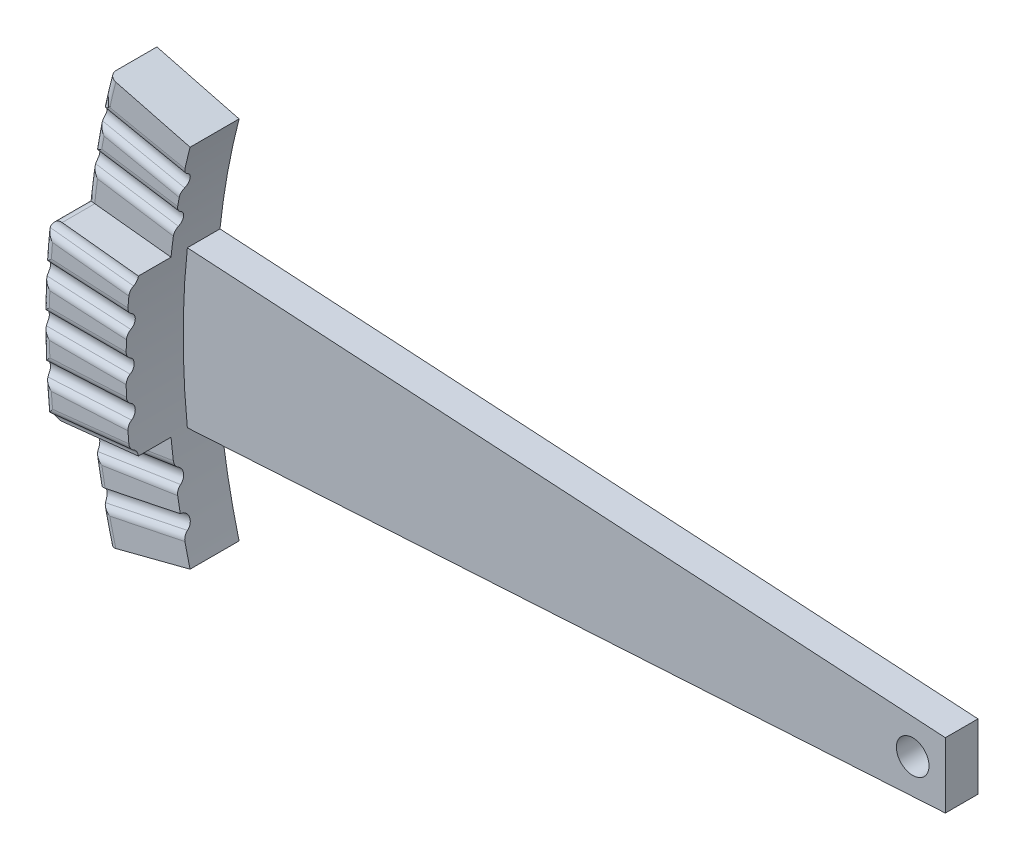
from build123d import *

# Parameters (mm, degrees)
MAIN_BODY_DEPTH                               = 1.5
UPPER_NOTCH_DEPTH                             = 1.25
UPPER_START                                   = -26
UPPER_NOTCH_RIDGE_CUT_DEPTH                   = 3.777933763
UPPER_NOTCH_RIDGE_CUT_PATTERN_COUNT           = 3
UPPER_NOTCH_RIDGE_CUT_PATTERN_ANGLE           = 6.140000000000013
UPPER_NOTCH_RIDGE_CUT_PATTERN_THE_OTHER_COUNT = 3
UPPER_NOTCH_RIDGE_CUT_PATTERN_THE_OTHER_ANGLE = 6.140000000000013
PIVOT_ARM_BODY_SKETCH_R                       = 0.5
PIVOT_ARM_BODY_DEPTH                          = 1
LOWER_NOTCH_RIDGE_CUT_SKETCH_R                = 0.25
LOWER_NOTCH_RIDGE_CUT_PATTERN_COUNT           = 2
LOWER_NOTCH_RIDGE_CUT_PATTERN_ANGLE           = 2.900000000000006
LOWER_NOTCH_RIDGE_CUT_PATTERN_MIRROR_COP_R    = 0.25
RIDGE_FILLETS_R                               = 0.25


with BuildPart() as part:
    # Main Body Sketch → Main Body (new body)
    with BuildSketch(Plane.XY):
        with BuildLine():
            Line((-24.15450268583479, 6.25), (-21.637400201539382, 5.598697394789582))
            ThreePointArc((-21.637400201539382, 5.598697394789582), (-22.35, -2.74e-15), (-21.637400201539382, -5.598697394789582))
            Line((-21.637400201539382, -5.598697394789582), (-24.15450268583479, -6.25))
            ThreePointArc((-24.15450268583479, -6.25), (-24.95, -3.06e-15), (-24.15450268583479, 6.25))
        make_face()
    extrude(amount=MAIN_BODY_DEPTH)

    # Upper Notch Sketch → Upper Notch (add)
    with BuildSketch(Plane.XY.offset(1.5)):
        with BuildLine():
            Line((-24.80718356191684, 2.665735119130029), (-22.222066236827313, 2.3879430826675807))
            ThreePointArc((-22.222066236827313, 2.3879430826675807), (-22.35000000000001, 2.74e-15), (-22.222066236827313, -2.3879430826675807))
            Line((-22.222066236827313, -2.3879430826675807), (-24.80718356191684, -2.665735119130029))
            ThreePointArc((-24.80718356191684, -2.665735119130029), (-24.950000000000006, 3.06e-15), (-24.80718356191684, 2.665735119130029))
        make_face()
    extrude(amount=UPPER_NOTCH_DEPTH)

    # Upper Notch Ridge Cut: read off the stored shape, not the designer's step
    # Upper Notch Ridge Cut outline → Upper Notch Ridge Cut (cut)
    with BuildSketch(Plane.YZ.offset(UPPER_START)):
        with BuildLine():
            Line((0.25, 2.75), (-0.25, 2.75))
            ThreePointArc((-0.25, 2.75), (0, 2.5), (0.25, 2.75))
        make_face()
    upper_notch_ridge_cut = extrude(amount=UPPER_NOTCH_RIDGE_CUT_DEPTH, mode=Mode.SUBTRACT)

    # Upper Notch Ridge Cut Pattern: Upper Notch Ridge Cut ×3 about axis
    upper_notch_ridge_cut_pattern_axis = Axis((0, 0, 2.75), (0, 0, -1))
    for i in range(1, UPPER_NOTCH_RIDGE_CUT_PATTERN_COUNT):
        add(upper_notch_ridge_cut.rotate(upper_notch_ridge_cut_pattern_axis, i * UPPER_NOTCH_RIDGE_CUT_PATTERN_ANGLE / (UPPER_NOTCH_RIDGE_CUT_PATTERN_COUNT - 1)), mode=Mode.SUBTRACT)

    # Upper Notch Ridge Cut Pattern the other: Upper Notch Ridge Cut ×3 about axis
    upper_notch_ridge_cut_pattern_the_other_axis = Axis((0, 0, 2.75), (0, 0, 1))
    for i in range(1, UPPER_NOTCH_RIDGE_CUT_PATTERN_THE_OTHER_COUNT):
        add(upper_notch_ridge_cut.rotate(upper_notch_ridge_cut_pattern_the_other_axis, i * UPPER_NOTCH_RIDGE_CUT_PATTERN_THE_OTHER_ANGLE / (UPPER_NOTCH_RIDGE_CUT_PATTERN_THE_OTHER_COUNT - 1)), mode=Mode.SUBTRACT)

    # Pivot Arm Body Sketch → Pivot Arm Body (add)
    with BuildSketch(Plane.XY):
        with BuildLine():
            Line((1, -0.9999999999999998), (0.9999999999999998, 1.0000000000000002))
            Line((0.9999999999999998, 1.0000000000000002), (-22.22206623682734, 2.387943082667429))
            ThreePointArc((-22.22206623682734, 2.387943082667429), (-22.35000000000002, 2.74e-15), (-22.22206623682734, -2.387943082667434))
            Line((-22.22206623682734, -2.387943082667434), (1, -0.9999999999999998))
        make_face()
        Circle(PIVOT_ARM_BODY_SKETCH_R, mode=Mode.SUBTRACT)
    extrude(amount=PIVOT_ARM_BODY_DEPTH)

    # Lower Notch Ridge Cut: sweep along a path in Lower Notch Ridge Cut Path
    with BuildLine(Plane.XY.offset(1.5)) as lower_notch_ridge_cut_path:
        Line((0, 0), (-24.433848267319885, -5.0487185353898685))
    # Lower Notch Ridge Cut Sketch → Lower Notch Ridge Cut (sweep, cut)
    with BuildSketch(Plane(origin=(0, 0, 1.5), x_dir=(0, 0, 1), z_dir=(-0.9793125558044041, -0.20235344831221916, 0))):
        Circle(LOWER_NOTCH_RIDGE_CUT_SKETCH_R)
    lower_notch_ridge_cut = sweep(path=lower_notch_ridge_cut_path.line, mode=Mode.SUBTRACT)

    # Lower Notch Ridge Cut Pattern: Lower Notch Ridge Cut ×2 about axis
    lower_notch_ridge_cut_pattern_axis = Axis((0, 0, 1.5), (0, 0, -1))
    for i in range(1, LOWER_NOTCH_RIDGE_CUT_PATTERN_COUNT):
        add(lower_notch_ridge_cut.rotate(lower_notch_ridge_cut_pattern_axis, i * LOWER_NOTCH_RIDGE_CUT_PATTERN_ANGLE / (LOWER_NOTCH_RIDGE_CUT_PATTERN_COUNT - 1)), mode=Mode.SUBTRACT)

    # Lower Notch Ridge Cut Pattern Mirror: Lower Notch Ridge Cut across plane
    add(lower_notch_ridge_cut.mirror(Plane.ZX), mode=Mode.SUBTRACT)

    # Lower Notch Ridge Cut Pattern Mirror 2: sweep along a path in Lower Notch Ridge Cut Pattern Mirror 3
    with BuildLine(Plane(origin=(0, 0, 1.5), x_dir=(0.9987193571841861, 0.050592940076713416, 0), z_dir=(0, 0, 1))) as lower_notch_ridge_cut_pattern_mirror_2_path:
        Line((0, 0), (-24.433848267319885, 5.0487185353898685))
    # Lower Notch Ridge Cut Pattern Mirror cop → Lower Notch Ridge Cut Pattern Mirror 2 (sweep, cut)
    with BuildSketch(Plane(origin=(0, 0, 1.5), x_dir=(0, 0, 1), z_dir=(-0.9882960621001533, 0.15254800437019767, 0))):
        Circle(LOWER_NOTCH_RIDGE_CUT_PATTERN_MIRROR_COP_R)
    sweep(path=lower_notch_ridge_cut_pattern_mirror_2_path.line, mode=Mode.SUBTRACT)

    # Ridge Fillets
    # the kernel refuses this fillet: 0.25 mm, written as the material it takes off along each edge
    with BuildSketch(Plane(origin=(-3.197e-14, 2.2e-16, 1.5), x_dir=(-0.9904771316155567, 0.1376773465266497, 0), z_dir=(-0.1376773465266497, -0.9904771316155567, 0))) as ridge_fillets_piece_1:
        with BuildLine():
            CenterArc((24.949999999999967 - RIDGE_FILLETS_R, RIDGE_FILLETS_R), RIDGE_FILLETS_R, 270, 90)
            Line((24.949999999999967, RIDGE_FILLETS_R), (24.949999999999967, 0))
            Line((24.949999999999967, 0), (24.949999999999967 - RIDGE_FILLETS_R, 0))
        make_face()
    ridge_fillets_piece_1_solid = revolve(axis=Axis((-3.197e-14, 2.2e-16, 1.5), (0, 0, -1)), revolution_arc=4.622299243658768, mode=Mode.PRIVATE)
    with BuildSketch(Plane(origin=(-21.488788064492436, 4.184905361020462, 1.5), x_dir=(0.05237292626537251, 0.25346474055021295, -0.965925826289066), z_dir=(-0.9793125558044041, 0.20235344831221916, 0))) as ridge_fillets_piece_2:
        with BuildLine():
            CenterArc((0.19411428382688892, 0.24148145657226713), RIDGE_FILLETS_R, 195.0000000000001, 60.00000000000023)
            Line((-0.04736717274537799, 0.17677669529663642), (0, 0))
            ThreePointArc((0, 0), (0.06470476127563021, 0.00851854342773308), (0.12940952255126043, 0))
        make_face()
    ridge_fillets_piece_2_solid = extrude(amount=3.515209227040651, mode=Mode.PRIVATE)
    with BuildSketch(Plane(origin=(-21.38761134033633, 4.6745616389226665, 1.5), x_dir=(0.20235344831221913, 0.9793125558044042, 0), z_dir=(-0.9793125558044041, 0.20235344831221916, 0))) as ridge_fillets_piece_3:
        with BuildLine():
            CenterArc((0.1830127018922193, 0.25000000000000006), RIDGE_FILLETS_R, 210, 60)
            ThreePointArc((-0.03349364905389055, 0.12500000000000003), (-0.00851854342773334, 0.06470476127562998), (0, 0))
            Line((0, 0), (0.1830127018922193, 0))
        make_face()
    ridge_fillets_piece_3_solid = extrude(amount=3.515209227040651, mode=Mode.PRIVATE)
    with BuildSketch(Plane(origin=(-3.197e-14, 2.2e-16, 1.5), x_dir=(-0.9942758942652038, 0.10684309094709553, 0), z_dir=(-0.10684309094709553, -0.9942758942652038, 0))) as ridge_fillets_piece_4:
        with BuildLine():
            CenterArc((24.949999999999974 - RIDGE_FILLETS_R, RIDGE_FILLETS_R), RIDGE_FILLETS_R, 270, 90)
            Line((24.949999999999974, RIDGE_FILLETS_R), (24.949999999999974, 0))
            Line((24.949999999999974, 0), (24.949999999999974 - RIDGE_FILLETS_R, 0))
        make_face()
    ridge_fillets_piece_4_solid = revolve(axis=Axis((-3.197e-14, 2.2e-16, 1.5), (0, 0, -1)), revolution_arc=3.50240050635555, mode=Mode.PRIVATE)
    with BuildSketch(Plane(origin=(-21.672995268593926, 3.092365025166951, 1.5), x_dir=(0.039482328823389555, 0.2557898430713422, -0.9659258262890685), z_dir=(-0.9882960621001534, 0.15254800437019767, 0))) as ridge_fillets_piece_5:
        with BuildLine():
            CenterArc((0.19411428382689072, 0.24148145657226722), RIDGE_FILLETS_R, 194.99999999999994, 60)
            Line((-0.0473671727453764, 0.17677669529663725), (0, 0))
            ThreePointArc((0, 0), (0.06470476127563024, 0.00851854342773269), (0.12940952255126034, 1e-17))
        make_face()
    ridge_fillets_piece_5_solid = extrude(amount=3.515209227040661, mode=Mode.PRIVATE)
    with BuildSketch(Plane(origin=(-21.59672126640883, 3.5865130562170284, 1.5), x_dir=(0.15254800437019767, 0.9882960621001533, 0), z_dir=(-0.9882960621001534, 0.15254800437019767, 0))) as ridge_fillets_piece_6:
        with BuildLine():
            CenterArc((0.1830127018922178, 0.25), RIDGE_FILLETS_R, 210.00000000000017, 59.99999999999983)
            ThreePointArc((-0.03349364905389141, 0.12499999999999933), (-0.00851854342773311, 0.06470476127562974), (0, 0))
            Line((0, 0), (0.1830127018922178, 0))
        make_face()
    ridge_fillets_piece_6_solid = extrude(amount=3.5152092270406503, mode=Mode.PRIVATE)
    with BuildSketch(Plane(origin=(-3.197e-14, 2.2e-16, 1.5), x_dir=(-0.9858917426492836, -0.16738420408138513, 0), z_dir=(0.16738420408138513, -0.9858917426492836, 0))) as ridge_fillets_piece_7:
        with BuildLine():
            CenterArc((24.949999999999974 - RIDGE_FILLETS_R, RIDGE_FILLETS_R), RIDGE_FILLETS_R, 270, 90)
            Line((24.949999999999974, RIDGE_FILLETS_R), (24.949999999999974, 0))
            Line((24.949999999999974, 0), (24.949999999999974 - RIDGE_FILLETS_R, 0))
        make_face()
    ridge_fillets_piece_7_solid = revolve(axis=Axis((-3.197e-14, 2.2e-16, 1.5), (0, 0, -1)), revolution_arc=3.50240050635566, mode=Mode.PRIVATE)
    with BuildSketch(Plane(origin=(-3.5705e-13, 0, 2.75), x_dir=(-0.9976471539131364, -0.06855768584935372, 0), z_dir=(0.06855768584935372, -0.9976471539131364, 0))) as ridge_fillets_piece_8:
        with BuildLine():
            CenterArc((24.94999999999965 - RIDGE_FILLETS_R, RIDGE_FILLETS_R), RIDGE_FILLETS_R, 270, 90)
            Line((24.94999999999965, RIDGE_FILLETS_R), (24.94999999999965, 0))
            Line((24.94999999999965, 0), (24.94999999999965 - RIDGE_FILLETS_R, 0))
        make_face()
    ridge_fillets_piece_8_solid = revolve(axis=Axis((-3.5705e-13, 0, 2.75), (0, 0, -1)), revolution_arc=4.792299332536204, mode=Mode.PRIVATE)
    with BuildSketch(Plane(origin=(-25.406279218280698, 0.25, 2.75), x_dir=(0, 1, 0), z_dir=(1, 0, 0))) as ridge_fillets_piece_9:
        with BuildLine():
            CenterArc((0.18301270189221974, -0.25), RIDGE_FILLETS_R, 90, 60)
            ThreePointArc((-0.03349364905388999, -0.125), (-0.00851854342773289, -0.06470476127562996), (0, 0))
            Line((0, 0), (0.18301270189221974, 0))
        make_face()
    ridge_fillets_piece_9_solid = extrude(amount=3.5152092270406357, mode=Mode.PRIVATE)
    with BuildSketch(Plane(origin=(-25.406279218280698, -0.25, 2.75), x_dir=(0, 0.25881904510251985, -0.9659258262890685), z_dir=(1, 0, 0))) as ridge_fillets_piece_10:
        with BuildLine():
            CenterArc((0.19411428382689075, -0.24148145657226708), RIDGE_FILLETS_R, 105.00000000000004, 60.000000000000014)
            Line((-0.04736717274537638, -0.17677669529663712), (0, 0))
            ThreePointArc((0, 0), (0.06470476127562999, -0.00851854342773279), (0.12940952255126034, 0))
        make_face()
    ridge_fillets_piece_10_solid = extrude(amount=3.5152092270406357, mode=Mode.PRIVATE)
    with BuildSketch(Plane(origin=(-3.5705e-13, 0, 2.75), x_dir=(-0.9998870532238777, -0.015029331165099169, 0), z_dir=(0.015029331165099169, -0.9998870532238777, 0))) as ridge_fillets_piece_11:
        with BuildLine():
            CenterArc((24.949999999999648 - RIDGE_FILLETS_R, RIDGE_FILLETS_R), RIDGE_FILLETS_R, 270, 90)
            Line((24.949999999999648, RIDGE_FILLETS_R), (24.949999999999648, 0))
            Line((24.949999999999648, 0), (24.949999999999648 - RIDGE_FILLETS_R, 0))
        make_face()
    ridge_fillets_piece_11_solid = revolve(axis=Axis((-3.5705e-13, 0, 2.75), (0, 0, -1)), revolution_arc=4.792299332536173, mode=Mode.PRIVATE)
    with BuildSketch(Plane(origin=(-25.356428379217775, 1.6102992165560097, 2.75), x_dir=(0.05355597301768554, 0.9985648490479369, 0), z_dir=(0.998564849047937, -0.05355597301768555, 0))) as ridge_fillets_piece_12:
        with BuildLine():
            CenterArc((0.18301270189221955, -0.25), RIDGE_FILLETS_R, 90, 60)
            ThreePointArc((-0.03349364905389016, -0.125), (-0.00851854342773282, -0.06470476127562996), (0, 0))
            Line((0, 0), (0.18301270189221955, 0))
        make_face()
    ridge_fillets_piece_12_solid = extrude(amount=3.515209227040654, mode=Mode.PRIVATE)
    with BuildSketch(Plane(origin=(-25.38320636572662, 1.1110167920320415, 2.75), x_dir=(0.013861305795973757, 0.2584476007035302, -0.9659258262890682), z_dir=(0.998564849047937, -0.05355597301768555, 0))) as ridge_fillets_piece_13:
        with BuildLine():
            CenterArc((0.19411428382689047, -0.2414814565722672), RIDGE_FILLETS_R, 104.99999999999997, 60.000000000000085)
            Line((-0.04736717274537668, -0.17677669529663728), (0, 0))
            ThreePointArc((0, 0), (0.06470476127563038, -0.00851854342773308), (0.1294095225512604, -1e-17))
        make_face()
    ridge_fillets_piece_13_solid = extrude(amount=3.5152092270406325, mode=Mode.PRIVATE)
    with BuildSketch(Plane(origin=(-3.5705e-13, 0, 2.75), x_dir=(-0.9992569748218397, 0.03854216223702459, 0), z_dir=(-0.03854216223702459, -0.9992569748218397, 0))) as ridge_fillets_piece_14:
        with BuildLine():
            CenterArc((24.949999999999648 - RIDGE_FILLETS_R, RIDGE_FILLETS_R), RIDGE_FILLETS_R, 270, 90)
            Line((24.949999999999648, RIDGE_FILLETS_R), (24.949999999999648, 0))
            Line((24.949999999999648, 0), (24.949999999999648 - RIDGE_FILLETS_R, 0))
        make_face()
    ridge_fillets_piece_14_solid = revolve(axis=Axis((-3.5705e-13, 0, 2.75), (0, 0, -1)), revolution_arc=4.792299332538099, mode=Mode.PRIVATE)
    with BuildSketch(Plane(origin=(-25.287276047608184, 2.468844630450399, 2.75), x_dir=(0.027682825459527795, 0.2573343336641243, -0.9659258262890678), z_dir=(0.9942635155082579, -0.10695822422404108, 0))) as ridge_fillets_piece_15:
        with BuildLine():
            CenterArc((0.1941142838268902, -0.24148145657226722), RIDGE_FILLETS_R, 104.9999999999999, 60.000000000000014)
            Line((-0.04736717274537677, -0.17677669529663667), (0, 0))
            ThreePointArc((0, 0), (0.06470476127563039, -0.00851854342773305), (0.12940952255126043, 0))
        make_face()
    ridge_fillets_piece_15_solid = extrude(amount=3.5152092270406525, mode=Mode.PRIVATE)
    with BuildSketch(Plane(origin=(-24.807183561916844, 2.665735119130029, 1.5), x_dir=(0.994275894265204, -0.10684309094709414, 0), z_dir=(0, 0, 1))) as ridge_fillets_piece_16:
        with BuildLine():
            CenterArc((0.2512652145904492, -0.2500000000000001), RIDGE_FILLETS_R, 89.99999999999996, 90.57992669863722)
            ThreePointArc((0.00127802040614027, -0.25253036437246834), (0.00031950714732543, -0.1262667991459455), (0, 0))
            Line((0, 0), (0.25126521459044937, 0))
        make_face()
    ridge_fillets_piece_16_solid = extrude(amount=1.631350690440975, mode=Mode.PRIVATE)
    with BuildSketch(Plane(origin=(-3.197e-14, 2.2e-16, 1.5), x_dir=(-0.9822431829234117, 0.18761217871045885, 0), z_dir=(-0.18761217871045885, -0.9822431829234117, 0))) as ridge_fillets_piece_17:
        with BuildLine():
            CenterArc((24.949999999999967 - RIDGE_FILLETS_R, RIDGE_FILLETS_R), RIDGE_FILLETS_R, 270, 90)
            Line((24.949999999999967, RIDGE_FILLETS_R), (24.949999999999967, 0))
            Line((24.949999999999967, 0), (24.949999999999967 - RIDGE_FILLETS_R, 0))
        make_face()
    ridge_fillets_piece_17_solid = revolve(axis=Axis((-3.197e-14, 2.2e-16, 1.5), (0, 0, -1)), revolution_arc=5.128959892514045, mode=Mode.PRIVATE)
    with BuildSketch(Plane(origin=(-3.5705e-13, 0, 2.75), x_dir=(-0.9925437060768677, -0.12188925927741316, 0), z_dir=(0.12188925927741316, -0.9925437060768677, 0))) as ridge_fillets_piece_18:
        with BuildLine():
            CenterArc((24.949999999999655 - RIDGE_FILLETS_R, RIDGE_FILLETS_R), RIDGE_FILLETS_R, 270, 90)
            Line((24.949999999999655, RIDGE_FILLETS_R), (24.949999999999655, 0))
            Line((24.949999999999655, 0), (24.949999999999655 - RIDGE_FILLETS_R, 0))
        make_face()
    ridge_fillets_piece_18_solid = revolve(axis=Axis((-3.5705e-13, 0, 2.75), (0, 0, -1)), revolution_arc=4.792299332538102, mode=Mode.PRIVATE)
    with BuildSketch(Plane(origin=(-25.356428379217782, -1.6102992165560102, 2.75), x_dir=(-0.0138613057959736, 0.25844760070352724, -0.965925826289069), z_dir=(0.998564849047937, 0.05355597301768555, 0))) as ridge_fillets_piece_19:
        with BuildLine():
            CenterArc((0.1941142838268911, -0.241481456572267), RIDGE_FILLETS_R, 105.00000000000014, 59.99999999999997)
            Line((-0.04736717274537609, -0.17677669529663725), (0, 0))
            ThreePointArc((0, 0), (0.06470476127562998, -0.00851854342773274), (0.1294095225512603, -1e-17))
        make_face()
    ridge_fillets_piece_19_solid = extrude(amount=3.515209227040661, mode=Mode.PRIVATE)
    with BuildSketch(Plane(origin=(-25.38320636572662, -1.1110167920320415, 2.75), x_dir=(-0.05355597301768555, 0.998564849047937, 0), z_dir=(0.998564849047937, 0.05355597301768555, 0))) as ridge_fillets_piece_20:
        with BuildLine():
            CenterArc((0.18301270189221935, -0.25000000000000006), RIDGE_FILLETS_R, 90, 59.99999999999997)
            ThreePointArc((-0.0334936490538902, -0.12500000000000003), (-0.00851854342773266, -0.06470476127563042), (0, 0))
            Line((0, 0), (0.18301270189221935, 0))
        make_face()
    ridge_fillets_piece_20_solid = extrude(amount=3.515209227040636, mode=Mode.PRIVATE)
    with BuildSketch(Plane(origin=(-24.807183561916837, -2.665735119130029, 1.5), x_dir=(0.9942758942652035, 0.10684309094709737, 0), z_dir=(0, 0, 1))) as ridge_fillets_piece_21:
        with BuildLine():
            CenterArc((0.2512652145904465, 0.25000000000000006), RIDGE_FILLETS_R, 179.42007330136195, 90.5799266986379)
            ThreePointArc((0.00127802040613794, 0.2525303643724722), (0.0003195071473225, 0.1262667991459476), (0, 0))
            Line((0, 0), (0.2512652145904458, 0))
        make_face()
    ridge_fillets_piece_21_solid = extrude(amount=1.6313506904409851, mode=Mode.PRIVATE)
    with BuildSketch(Plane(origin=(-25.287276047608184, -2.468844630450399, 2.75), x_dir=(-0.10695822422404107, 0.9942635155082579, 0), z_dir=(0.9942635155082579, 0.10695822422404108, 0))) as ridge_fillets_piece_22:
        with BuildLine():
            CenterArc((0.18301270189221922, -0.25), RIDGE_FILLETS_R, 90, 60)
            ThreePointArc((-0.03349364905389051, -0.125), (-0.00851854342773291, -0.0647047612756304), (0, 0))
            Line((0, 0), (0.18301270189221922, 0))
        make_face()
    ridge_fillets_piece_22_solid = extrude(amount=3.5152092270406525, mode=Mode.PRIVATE)
    with BuildSketch(Plane(origin=(-3.197e-14, 2.2e-16, 1.5), x_dir=(-0.96153818517032, -0.2746712916548934, 0), z_dir=(0.2746712916548934, -0.96153818517032, 0))) as ridge_fillets_piece_23:
        with BuildLine():
            CenterArc((24.949999999999974 - RIDGE_FILLETS_R, RIDGE_FILLETS_R), RIDGE_FILLETS_R, 270, 90)
            Line((24.949999999999974, RIDGE_FILLETS_R), (24.949999999999974, 0))
            Line((24.949999999999974, 0), (24.949999999999974 - RIDGE_FILLETS_R, 0))
        make_face()
    ridge_fillets_piece_23_solid = revolve(axis=Axis((-3.197e-14, 2.2e-16, 1.5), (0, 0, -1)), revolution_arc=5.128959892514349, mode=Mode.PRIVATE)
    with BuildSketch(Plane(origin=(-21.38761134033633, -4.6745616389226665, 1.5), x_dir=(-0.052372926265371066, 0.25346474055020596, -0.965925826289068), z_dir=(-0.9793125558044041, -0.20235344831221916, 0))) as ridge_fillets_piece_24:
        with BuildLine():
            CenterArc((0.19411428382689028, 0.24148145657226738), RIDGE_FILLETS_R, 195.00000000000009, 60.00000000000006)
            Line((-0.04736717274537668, 0.17677669529663678), (0, 0))
            ThreePointArc((0, 0), (0.06470476127563006, 0.00851854342773254), (0.12940952255126065, 0))
        make_face()
    ridge_fillets_piece_24_solid = extrude(amount=3.5152092270406476, mode=Mode.PRIVATE)
    with BuildSketch(Plane(origin=(-3.197e-14, 2.2e-16, 1.5), x_dir=(-0.9761607087896695, -0.2170490051008061, 0), z_dir=(0.2170490051008061, -0.9761607087896695, 0))) as ridge_fillets_piece_25:
        with BuildLine():
            CenterArc((24.94999999999997 - RIDGE_FILLETS_R, RIDGE_FILLETS_R), RIDGE_FILLETS_R, 270, 90)
            Line((24.94999999999997, RIDGE_FILLETS_R), (24.94999999999997, 0))
            Line((24.94999999999997, 0), (24.94999999999997 - RIDGE_FILLETS_R, 0))
        make_face()
    ridge_fillets_piece_25_solid = revolve(axis=Axis((-3.197e-14, 2.2e-16, 1.5), (0, 0, -1)), revolution_arc=4.622299243659174, mode=Mode.PRIVATE)
    with BuildSketch(Plane(origin=(-21.596721266408828, -3.5865130562170284, 1.5), x_dir=(-0.03948232882338901, 0.2557898430713386, -0.9659258262890694), z_dir=(-0.9882960621001534, -0.1525480043701977, 0))) as ridge_fillets_piece_26:
        with BuildLine():
            CenterArc((0.1941142838268915, 0.24148145657226686), RIDGE_FILLETS_R, 194.99999999999972, 60.00000000000006)
            Line((-0.04736717274537584, 0.17677669529663784), (0, 0))
            ThreePointArc((0, 0), (0.06470476127563016, 0.00851854342773286), (0.12940952255126043, 0))
        make_face()
    ridge_fillets_piece_26_solid = extrude(amount=3.5152092270406614, mode=Mode.PRIVATE)
    with BuildSketch(Plane(origin=(-21.67299526859393, -3.092365025166952, 1.5), x_dir=(-0.1525480043701977, 0.9882960621001534, 0), z_dir=(-0.9882960621001534, -0.1525480043701977, 0))) as ridge_fillets_piece_27:
        with BuildLine():
            CenterArc((0.18301270189221913, 0.25000000000000006), RIDGE_FILLETS_R, 210.00000000000006, 59.99999999999994)
            ThreePointArc((-0.03349364905389053, 0.1249999999999998), (-0.00851854342773311, 0.06470476127563042), (0, 0))
            Line((0, 0), (0.18301270189221913, 0))
        make_face()
    ridge_fillets_piece_27_solid = extrude(amount=3.5152092270406503, mode=Mode.PRIVATE)
    with BuildSketch(Plane(origin=(-3.197e-14, 2.2e-16, 1.5), x_dir=(-0.9966401034415856, 0.08190545898745415, 0), z_dir=(-0.08190545898745415, -0.9966401034415856, 0))) as ridge_fillets_piece_28a_section:
        with BuildLine():
            CenterArc((24.94999999999997 - RIDGE_FILLETS_R, RIDGE_FILLETS_R), RIDGE_FILLETS_R, 270, 90)
            Line((24.94999999999997, RIDGE_FILLETS_R), (24.94999999999997, 0))
            Line((24.94999999999997, 0), (24.94999999999997 - RIDGE_FILLETS_R, 0))
        make_face()
    ridge_fillets_piece_28a = revolve(axis=Axis((-3.197e-14, 2.2e-16, 1.5), (0, 0, -1)), revolution_arc=4.9376658282882495, mode=Mode.PRIVATE)
    ridge_fillets_piece_28a = split(ridge_fillets_piece_28a, bisect_by=Plane(origin=(-3.243e-14, -3.98e-15, 1.5), z_dir=(-0.10684309094709565, -0.9942758942652038, 0)), keep=Keep.TOP, mode=Mode.PRIVATE)
    with BuildSketch(Plane(origin=(-24.807183561916844, 2.665735119130029, 0.8686660042702727), x_dir=(0.994275894265204, -0.10684309094709414, 0), z_dir=(0, 0, 1))) as ridge_fillets_piece_28b_section:
        with BuildLine():
            CenterArc((0.2512652145904492, -0.2500000000000001), RIDGE_FILLETS_R, 89.99999999999996, 90.57992669863722)
            ThreePointArc((0.00127802040614027, -0.25253036437246834), (0.00031950714732543, -0.1262667991459455), (0, 0))
            Line((0, 0), (0.25126521459044937, 0))
        make_face()
    ridge_fillets_piece_28b = extrude(amount=2.262684686170702, mode=Mode.PRIVATE)
    ridge_fillets_piece_28b = split(ridge_fillets_piece_28b, bisect_by=Plane(origin=(-24.807183561916844, 2.665735119130029, 1.5), z_dir=(0, 0, -1)), keep=Keep.TOP, mode=Mode.PRIVATE)
    ridge_fillets_piece_28 = ridge_fillets_piece_28a & ridge_fillets_piece_28b
    with BuildSketch(Plane(origin=(-24.807183561916837, -2.665735119130029, 0.868666004270263), x_dir=(0.9942758942652035, 0.10684309094709737, 0), z_dir=(0, 0, 1))) as ridge_fillets_piece_29a_section:
        with BuildLine():
            CenterArc((0.2512652145904465, 0.25000000000000006), RIDGE_FILLETS_R, 179.42007330136195, 90.5799266986379)
            ThreePointArc((0.00127802040613794, 0.2525303643724722), (0.0003195071473225, 0.1262667991459476), (0, 0))
            Line((0, 0), (0.2512652145904458, 0))
        make_face()
    ridge_fillets_piece_29a = extrude(amount=2.262684686170722, mode=Mode.PRIVATE)
    ridge_fillets_piece_29a = split(ridge_fillets_piece_29a, bisect_by=Plane(origin=(-24.807183561916837, -2.665735119130029, 1.5), z_dir=(0, 0, -1)), keep=Keep.TOP, mode=Mode.PRIVATE)
    with BuildSketch(Plane(origin=(-3.197e-14, 2.2e-16, 1.5), x_dir=(-0.9858917426492836, -0.16738420408138513, 0), z_dir=(0.16738420408138513, -0.9858917426492836, 0))) as ridge_fillets_piece_29b_section:
        with BuildLine():
            CenterArc((24.949999999999974 - RIDGE_FILLETS_R, RIDGE_FILLETS_R), RIDGE_FILLETS_R, 270, 90)
            Line((24.949999999999974, RIDGE_FILLETS_R), (24.949999999999974, 0))
            Line((24.949999999999974, 0), (24.949999999999974 - RIDGE_FILLETS_R, 0))
        make_face()
    ridge_fillets_piece_29b = revolve(axis=Axis((-3.197e-14, 2.2e-16, 1.5), (0, 0, -1)), revolution_arc=4.9376658282883605, mode=Mode.PRIVATE)
    ridge_fillets_piece_29b = split(ridge_fillets_piece_29b, bisect_by=Plane(origin=(-3.247e-14, 4.86e-15, 1.5), z_dir=(-0.10684309094709565, 0.9942758942652038, 0)), keep=Keep.TOP, mode=Mode.PRIVATE)
    ridge_fillets_piece_29 = ridge_fillets_piece_29a & ridge_fillets_piece_29b
    add([ridge_fillets_piece_1_solid, ridge_fillets_piece_2_solid, ridge_fillets_piece_3_solid, ridge_fillets_piece_4_solid, ridge_fillets_piece_5_solid, ridge_fillets_piece_6_solid, ridge_fillets_piece_7_solid, ridge_fillets_piece_8_solid, ridge_fillets_piece_9_solid, ridge_fillets_piece_10_solid, ridge_fillets_piece_11_solid, ridge_fillets_piece_12_solid, ridge_fillets_piece_13_solid, ridge_fillets_piece_14_solid, ridge_fillets_piece_15_solid, ridge_fillets_piece_16_solid, ridge_fillets_piece_17_solid, ridge_fillets_piece_18_solid, ridge_fillets_piece_19_solid, ridge_fillets_piece_20_solid, ridge_fillets_piece_21_solid, ridge_fillets_piece_22_solid, ridge_fillets_piece_23_solid, ridge_fillets_piece_24_solid, ridge_fillets_piece_25_solid, ridge_fillets_piece_26_solid, ridge_fillets_piece_27_solid, ridge_fillets_piece_28, ridge_fillets_piece_29], mode=Mode.SUBTRACT)


solid = part.part
